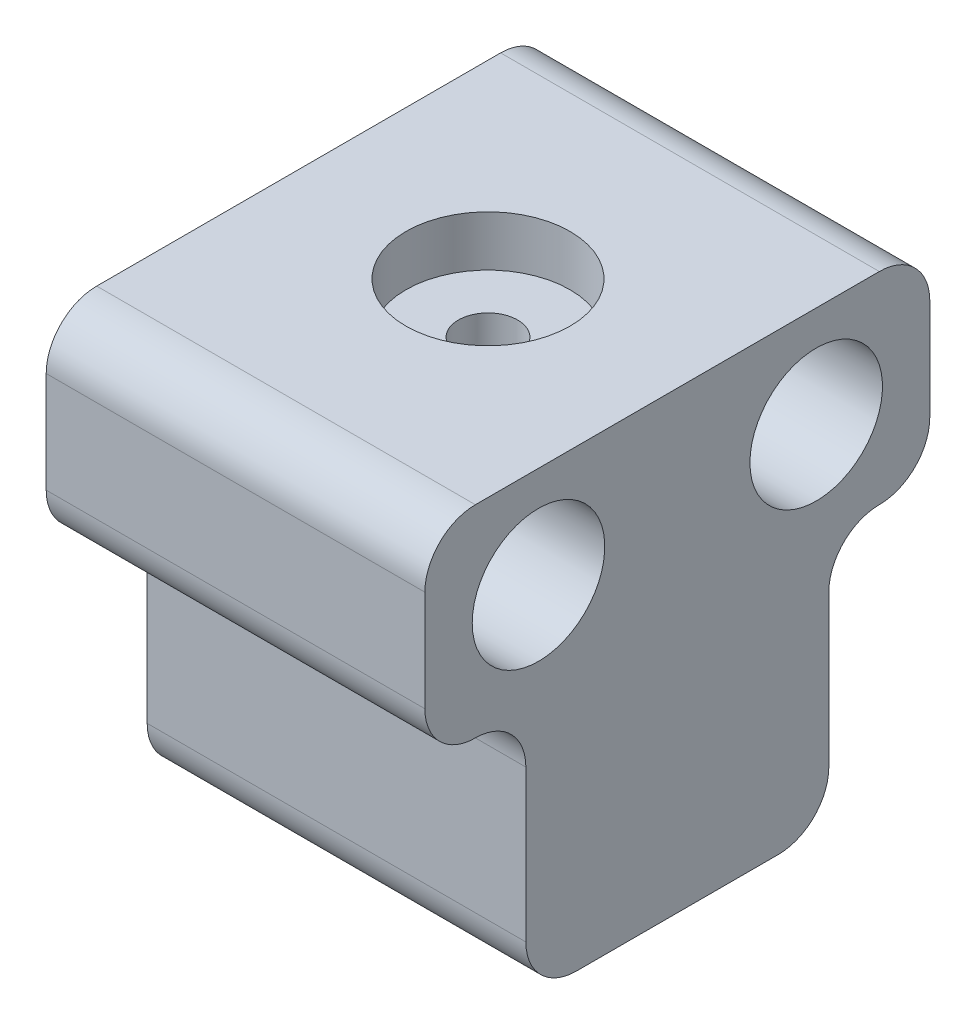
from build123d import *

# Parameters (mm, degrees)
SKETCH1_W           = 30
SKETCH1_H           = 40
BOSS_EXTRUDE1_DEPTH = 36
CUT_EXTRUDE1_START  = 14
CUT_EXTRUDE1_DEPTH  = 37.378214609
SKETCH4_R           = 2.35
CUT_EXTRUDE3_DEPTH  = 51.378214609
SKETCH5_R           = 6.5
CUT_EXTRUDE4_DEPTH  = 4
SKETCH12_R          = 5.25
SKETCH12_W          = 8
SKETCH12_H          = 20
CUT_EXTRUDE5_DEPTH  = 57.683017802
FILLET1_R           = 4


with BuildPart() as part:
    # Sketch1 → Boss-Extrude1 (new body)
    with BuildSketch(Plane(origin=(0, 0, 0), x_dir=(1, 0, 0), z_dir=(0, 1, 0))):
        with Locations((0, -11.889880952)):
            Rectangle(SKETCH1_W, SKETCH1_H)
    extrude(amount=BOSS_EXTRUDE1_DEPTH)

    # Sketch2 → Cut-Extrude1 (cut, through all)
    with BuildSketch(Plane.XZ.offset(-36).offset(CUT_EXTRUDE1_START)):
        Polygon((-11.25, 21.389880952), (-5.5, 21.389880952), (-5.5, 18.389880952), (5.5, 18.389880952), (5.5, 21.389880952), (11.25, 21.389880952), (11.25, 2.389880952), (5.5, 2.389880952), (5.5, 5.389880952), (-5.5, 5.389880952), (-5.5, 2.389880952), (-11.25, 2.389880952), align=None)
    extrude(amount=CUT_EXTRUDE1_DEPTH, mode=Mode.SUBTRACT)

    # Sketch4 → Cut-Extrude3 (cut, through all)
    with BuildSketch(Plane(origin=(0, 36, 0), x_dir=(1, 0, 0), z_dir=(0, 1, 0))):
        with Locations(Location((0, -11.889880952, 0), (0, 0, 270))):
            Circle(SKETCH4_R)
    extrude(amount=-CUT_EXTRUDE3_DEPTH, mode=Mode.SUBTRACT)

    # Sketch5 → Cut-Extrude4 (cut)
    with BuildSketch(Plane(origin=(0, 36, 0), x_dir=(1, 0, 0), z_dir=(0, 1, 0))):
        with Locations(Location((0, -11.889880952, 0), (0, 0, 270))):
            Circle(SKETCH5_R)
    extrude(amount=-CUT_EXTRUDE4_DEPTH, mode=Mode.SUBTRACT)

    # Sketch12 → Cut-Extrude5 (cut, through all)
    with BuildSketch(Plane.ZY.offset(15)):
        with Locations((0.889880952, 28)):
            Circle(SKETCH12_R)
        with Locations((22.889880952, 28)):
            Circle(SKETCH12_R)
        with Locations((-4.110119048, 10)):
            Rectangle(SKETCH12_W, SKETCH12_H)
        with Locations((27.889880952, 10)):
            Rectangle(SKETCH12_W, SKETCH12_H)
    extrude(amount=-CUT_EXTRUDE5_DEPTH, mode=Mode.SUBTRACT)

    # Fillet1
    # the kernel refuses this fillet: 4 mm, written as the material it adds along each edge
    with BuildSketch(Plane(origin=(-15, 20, -0.110119048), x_dir=(0, 0, -1), z_dir=(1, 0, 0)), Plane(origin=(-15, 20, 23.889880952), x_dir=(0, -1, 0), z_dir=(1, 0, 0))) as fillet1_piece_1:
        with BuildLine():
            CenterArc((FILLET1_R, -FILLET1_R), FILLET1_R, 90, 90)
            Line((0, -FILLET1_R), (0, 0))
            Line((0, 0), (FILLET1_R, 0))
        make_face()
    extrude(amount=30)
    # the kernel refuses this fillet: 4 mm, written as the material it takes off along each edge
    with BuildSketch(Plane(origin=(-25, 0, 23.889880952), x_dir=(0, 0, -1), z_dir=(1, 0, 0)), Plane(origin=(-25, 0, -0.110119048), x_dir=(0, 1, 0), z_dir=(1, 0, 0)), Plane(origin=(-25, 20, -8.110119048), x_dir=(0, 1, 0), z_dir=(1, 0, 0)), Plane(origin=(25, 36, 31.889880952), x_dir=(0, 0, -1), z_dir=(-1, 0, 0)), Plane(origin=(-25, 20, 31.889880952), x_dir=(0, 0, -1), z_dir=(1, 0, 0))) as fillet1_2_piece_1:
        with BuildLine():
            CenterArc((FILLET1_R, FILLET1_R), FILLET1_R, 180, 90)
            Line((0, FILLET1_R), (0, 0))
            Line((0, 0), (FILLET1_R, 0))
        make_face()
    extrude(amount=50, mode=Mode.SUBTRACT)
    with BuildSketch(Plane(origin=(-25, 36, -8.110119048), x_dir=(0, -1, 0), z_dir=(1, 0, 0))) as fillet1_2_piece_2:
        with BuildLine():
            CenterArc((FILLET1_R, -FILLET1_R), FILLET1_R, 90, 90)
            Line((0, -FILLET1_R), (0, 0))
            Line((0, 0), (FILLET1_R, 0))
        make_face()
    extrude(amount=50, mode=Mode.SUBTRACT)


solid = part.part
